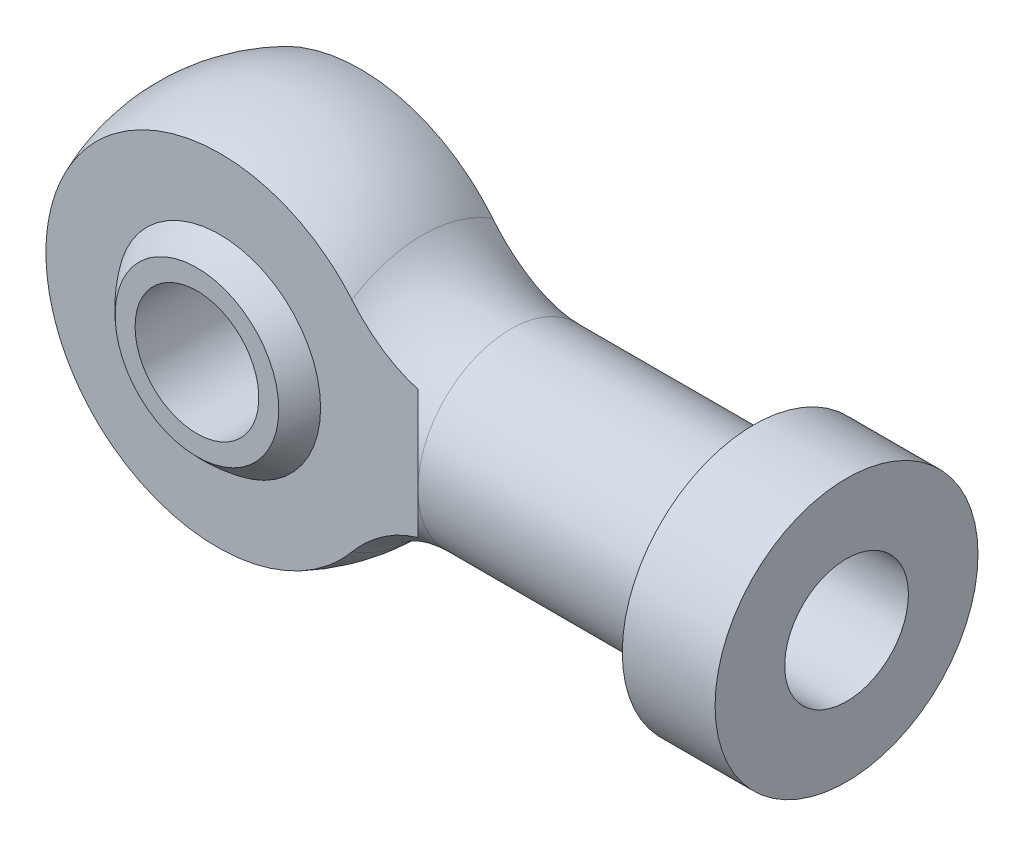
from build123d import *

# Parameters (mm, degrees)
CUT_EXTRUDE_1_DEPTH = 12.5
SKETCH_4_R          = 4
CUT_EXTRUDE_2_DEPTH = 21
SKETCH_6_R          = 4
CUT_EXTRUDE_3_DEPTH = 21


with BuildPart() as part:
    # 草图1 → 旋转3 (revolve)
    with BuildSketch(Plane.XY):
        with BuildLine():
            Line((36, 0), (36, 8.5))
            Line((36, 8.5), (30, 8.5))
            Line((30, 8.5), (30, 6))
            Line((30, 6), (14.282856857, 6))
            ThreePointArc((14.282856857, 6), (11.18447018, 6.624364434), (8.569714114, 8.4))
            ThreePointArc((8.569714114, 8.4), (-4.536707541, 11.109378231), (-12, 0))
            Line((-12, 0), (-4, 0))
            ThreePointArc((-4, 0), (0, 4), (4, 0))
            Line((4, 0), (36, 0))
        make_face()
    revolve(axis=Axis((36, 0, 0), (-1, 0, 0)))

    # 草图2 → 切除-拉伸1 (cut, symmetric)
    with BuildSketch(Plane(origin=(0, 0, 0), x_dir=(1, 0, 0), z_dir=(0, 1, 0))):
        with BuildLine():
            Line((12.79642365, 4.513566798), (14.282856857, 6))
            Line((14.282856857, 6), (5.630326423, 10.597142276))
            ThreePointArc((5.630326424, 10.597142276), (-3.985808769, 11.318715853), (-11.028032539, 4.731014522))
            Line((-11.028032539, 4.731014521), (-6.48139111, 4.68951696))
            Line((-6.48139111, 4.68951696), (12.79642365, 4.513566798))
        make_face()
        with BuildLine():
            Line((5.630326419, -10.597142273), (14.282856857, -6))
            Line((14.282856857, -6), (12.796423652, -4.513566795))
            Line((12.796423652, -4.513566795), (-6.481391109, -4.689516958))
            Line((-6.481391109, -4.689516958), (-11.028032538, -4.731014519))
            ThreePointArc((-11.028032538, -4.731014519), (-3.98580877, -11.318715847), (5.630326419, -10.597142274))
        make_face()
    extrude(amount=CUT_EXTRUDE_1_DEPTH, both=True, mode=Mode.SUBTRACT)

    # 草图3 → 旋转6 (revolve)
    with BuildSketch(Plane(origin=(0, 0, 0), x_dir=(1, 0, 0), z_dir=(0, 1, 0))):
        with BuildLine():
            Line((6.570843405, -4.563333972), (6.570843405, 4.563333972))
            ThreePointArc((6.570843405, 4.563333972), (5.974513841, 5.320261682), (5.291502622, 6))
            Line((5.291502622, 6), (0, 6))
            Line((0, 6), (0, -6))
            Line((0, -6), (5.291502622, -6))
            ThreePointArc((5.291502622, -6), (5.974513841, -5.320261682), (6.570843405, -4.563333972))
        make_face()
    revolve(axis=Axis((0, 0, -6), (0, 0, 1)))

    # 草图4 → 切除-拉伸2 (cut)
    with BuildSketch(Plane(origin=(0, 0, -6), x_dir=(-1, 0, 0), z_dir=(0, 0, -1))):
        Circle(SKETCH_4_R)
    extrude(amount=-CUT_EXTRUDE_2_DEPTH, mode=Mode.SUBTRACT)

    # 草图6 → 切除-拉伸3 (cut)
    with BuildSketch(Plane(origin=(36, 0, 0), x_dir=(0, 0, -1), z_dir=(1, 0, 0))):
        Circle(SKETCH_6_R)
    extrude(amount=-CUT_EXTRUDE_3_DEPTH, mode=Mode.SUBTRACT)


solid = part.part
